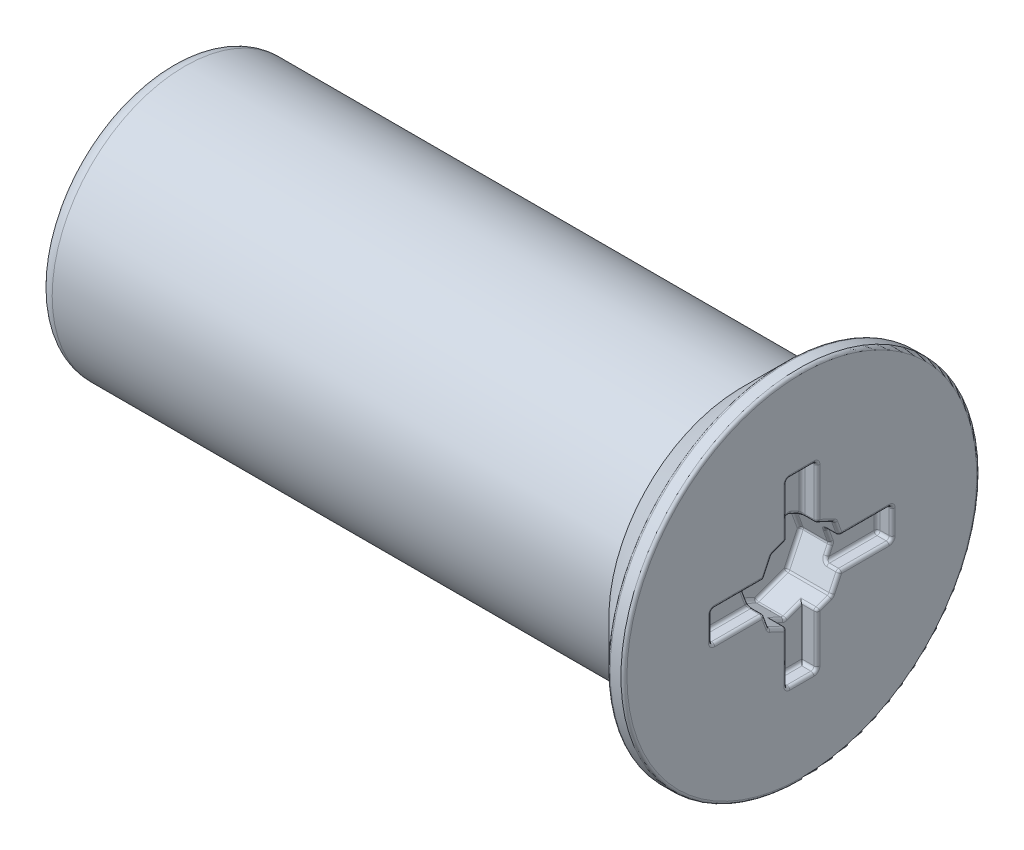
from build123d import *

# Parameters (mm, degrees)
SKETCH1_R           = 11.825000000000001
BOSS_EXTRUDE1_DEPTH = 3.9999999999999933
CHAMFER1_SIZE       = 3
SKETCH2_R           = 8.824999999999992
BOSS_EXTRUDE2_DEPTH = 38.00000000000001
FILLET2_R           = 1
CUT_EXTRUDE1_DEPTH  = 1
CUT_EXTRUDE4_DEPTH  = 3
FILLET3_R           = 0.2
FILLET4_R           = 0.2


with BuildPart() as part:
    # Sketch1 → Boss-Extrude1 (new body)
    with BuildSketch(Plane(origin=(0, 0, 0), x_dir=(0, 0, -1), z_dir=(1, 0, 0))):
        Circle(SKETCH1_R)
    extrude(amount=-BOSS_EXTRUDE1_DEPTH)

    # Chamfer1
    chamfer1_edges = [part.edges().sort_by_distance(p)[0] for p in [
        (-3.9999999999999933, 6.7e-15, 11.825000000000001),
    ]]
    chamfer(chamfer1_edges, length=CHAMFER1_SIZE)

    # Sketch2 → Boss-Extrude2 (add)
    with BuildSketch(Plane.ZY.offset(3.9999999999999933)):
        Circle(SKETCH2_R)
    extrude(amount=BOSS_EXTRUDE2_DEPTH)

    # Fillet2
    fillet2_edges = [part.edges().sort_by_distance(p)[0] for p in [
        (-42, 1.08e-15, -8.824999999999992),
    ]]
    fillet(fillet2_edges, radius=FILLET2_R)

    # Sketch3 → Cut-Extrude1 (cut)
    with BuildSketch(Plane(origin=(0, 0, 0), x_dir=(0, 0, -1), z_dir=(1, 0, 0))):
        Polygon((-5.999999999999999, 1), (-5.999999999999999, -1), (-2.504721568735346, -1), (-2.1548313138481494, -1.9670249149349557), (-0.9999999999999984, -2.5082036078498766), (-0.9999999999999981, -5.999999999999999), (1.0000000000000018, -5.999999999999999), (1.000000000000002, -2.5047215687353477), (1.967024914934957, -2.1548313138481507), (2.508203607849879, -1), (6.000000000000001, -1), (6.000000000000001, 1), (2.5047215687353512, 1), (2.154831313848155, 1.9670249149349543), (1.0000000000000018, 2.5082036078498775), (1.000000000000002, 6.000000000000001), (-0.9999999999999981, 6.000000000000001), (-0.9999999999999981, 2.5047215687353495), (-1.9670249149349508, 2.1548313138481525), (-2.508203607849874, 1), align=None)
    extrude(amount=-CUT_EXTRUDE1_DEPTH, mode=Mode.SUBTRACT)

    # Sketch3<7> → Cut-Extrude4 (cut)
    with BuildSketch(Plane(origin=(0, 0, 0), x_dir=(0, 0, -1), z_dir=(1, 0, 0))):
        Polygon((-2.914592490448541, 0.13279917822174797), (-2.1548313138481494, -1.9670249149349557), (-0.1327991782217457, -2.9145924904485434), (1.967024914934957, -2.1548313138481507), (2.9145924904485465, -0.13279917822174747), (2.154831313848155, 1.9670249149349543), (0.13279917822175102, 2.9145924904485443), (-1.9670249149349508, 2.1548313138481525), align=None)
    extrude(amount=-CUT_EXTRUDE4_DEPTH, mode=Mode.SUBTRACT)

    # Fillet3
    fillet3_edges = [part.edges().sort_by_distance(p)[0] for p in [
        (0, 1, 4.254101803924937),
        (0, -1, 4.2523607843676725),
        (0, -4.254101803924938, 0.9999999999999981),
        (0, -4.252360784367673, -1.000000000000002),
        (0, -1, -4.25410180392494),
        (0, 1, -4.252360784367676),
        (0, 4.254101803924939, -1.000000000000002),
        (0, 4.252360784367675, 0.9999999999999981),
        (-0.5, 1, 5.999999999999999),
        (-0.5, -1, 5.999999999999999),
        (0, 0, 5.999999999999999),
        (-0.5, -1, 2.504721568735346),
        (0, -1.4835124574674778, 2.329776441291748),
        (-1.5, -1.9670249149349557, 2.1548313138481494),
        (-1, -2.71139804914921, 0.5663995891108717),
        (-0.5, -2.5082036078498766, 0.9999999999999982),
        (0, -2.237614261392416, 1.577415656924074),
        (-0.5, -2.5047215687353477, -1.0000000000000022),
        (-1, -2.7096570295919453, -0.4336004108891282),
        (-2, -2.9145924904485434, 0.13279917822174575),
        (0, -2.329776441291749, -1.4835124574674796),
        (-1.5, -2.1548313138481507, -1.967024914934957),
        (-0.5, -1, -2.5082036078498793),
        (0, -1.5774156569240754, -2.2376142613924177),
        (-0.5, 0.9999999999999999, -2.5047215687353512),
        (-2, -0.1327991782217475, -2.9145924904485465),
        (0, 1.483512457467477, -2.329776441291753),
        (-1.5, 1.9670249149349543, -2.154831313848155),
        (-0.5, 2.508203607849878, -1.0000000000000018),
        (0, 2.237614261392416, -1.5774156569240785),
        (-0.5, 2.504721568735349, 0.9999999999999982),
        (-2, 2.9145924904485443, -0.13279917822175097),
        (0, 2.3297764412917505, 1.4835124574674745),
        (-1.5, 2.1548313138481525, 1.9670249149349508),
        (-2, 0.13279917822174794, 2.914592490448541),
        (-0.5, 1, 2.508203607849874),
        (0, 1.5774156569240763, 2.2376142613924124),
        (-0.5, -5.999999999999999, 0.9999999999999981),
        (-1, -5.999999999999999, -1.89e-15),
        (-0.5, -5.999999999999999, -1.0000000000000018),
        (0, -5.999999999999999, -1.89e-15),
        (-0.5, -1, -6.000000000000001),
        (-0.5, 1, -6.000000000000001),
        (0, 0, -6.000000000000001),
        (-0.5, 6.000000000000001, -1.0000000000000018),
        (-0.5, 6.000000000000001, 0.9999999999999981),
        (0, 6.000000000000001, -1.78e-15),
        (-1, -1, 4.2523607843676725),
        (-1, 0, 5.999999999999999),
        (-1, 1, 4.254101803924937),
        (-1, 0.566399589110874, 2.7113980491492073),
        (-1, -0.43360041088912615, 2.709657029591944),
        (-1, 4.252360784367675, 0.9999999999999981),
        (-1, 6.000000000000001, -1.78e-15),
        (-1, 4.254101803924939, -1.000000000000002),
        (-1, 2.711398049149211, -0.5663995891108764),
        (-1, 2.7096570295919467, 0.4336004108891236),
        (-1, 1, -4.252360784367676),
        (-1, 0, -6.000000000000001),
        (-1, -1, -4.25410180392494),
        (-1, -0.5663995891108737, -2.711398049149213),
        (-1, 0.43360041088912626, -2.709657029591949),
        (-3, 2.4408087026917493, -1.143815246034953),
        (-3, 0.9171128683566034, -2.534711902148351),
        (-3, -1.143815246034949, -2.4408087026917515),
        (-3, -2.534711902148347, -0.9171128683566055),
        (-3, -2.4408087026917493, 1.1438152460349476),
        (-3, -0.9171128683566039, 2.534711902148345),
        (-3, 1.1438152460349502, 2.440808702691746),
        (-3, 2.5347119021483486, 0.9171128683566),
    ]]
    fillet(fillet3_edges, radius=FILLET3_R)

    # Fillet4
    fillet4_edges = [part.edges().sort_by_distance(p)[0] for p in [
        (-0.9999999999999933, 6.7e-15, 11.825000000000001),
        (0, 6.7e-15, 11.825000000000001),
    ]]
    fillet(fillet4_edges, radius=FILLET4_R)


solid = part.part
